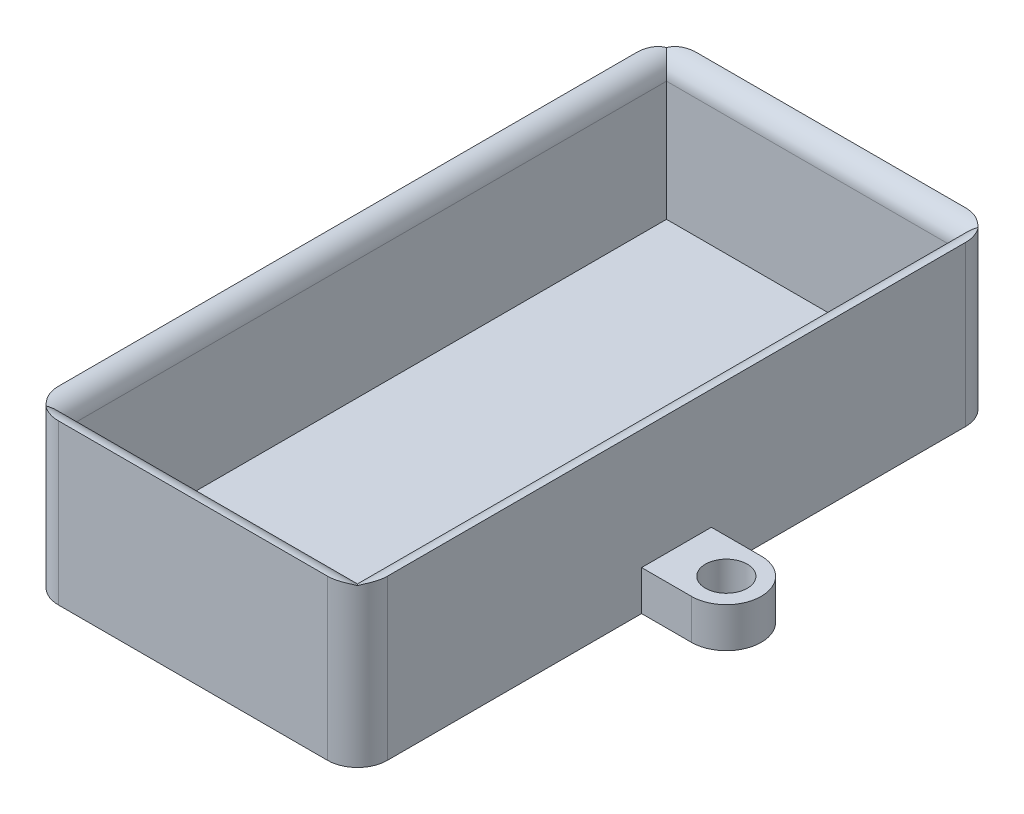
from build123d import *

# Parameters (mm, degrees)
SKETCH2_W           = 33
SKETCH2_H           = 64
SKETCH2_W_2         = 29
SKETCH2_H_2         = 60
BOSS_EXTRUDE1_DEPTH = 14
SKETCH3_W           = 33
SKETCH3_H           = 64
BOSS_EXTRUDE2_DEPTH = 2
SKETCH4_R           = 2.1
BOSS_EXTRUDE3_DEPTH = 4
FILLET1_R           = 3
FILLET2_R           = 2


with BuildPart() as part:
    # Sketch2 → Boss-Extrude1 (new body)
    with BuildSketch(Plane(origin=(0, 0, 0), x_dir=(1, 0, 0), z_dir=(0, 1, 0))):
        Rectangle(SKETCH2_W, SKETCH2_H)
        Rectangle(SKETCH2_W_2, SKETCH2_H_2, mode=Mode.SUBTRACT)
    extrude(amount=BOSS_EXTRUDE1_DEPTH)

    # Sketch3 → Boss-Extrude2 (add)
    with BuildSketch(Plane.XZ):
        Rectangle(SKETCH3_W, SKETCH3_H)
    extrude(amount=BOSS_EXTRUDE2_DEPTH)

    # Sketch4 → Boss-Extrude3 (add)
    # profile 1 of 2: a face of its own
    with BuildSketch(Plane.XZ.offset(2)):
        with BuildLine():
            Line((-21.5, 3.5), (-16.5, 3.5))
            Line((-16.5, 3.5), (-16.5, -3.5))
            Line((-16.5, -3.5), (-21.5, -3.5))
            ThreePointArc((-21.5, -3.5), (-25, 0), (-21.5, 3.5))
        make_face()
        with Locations(Location((-21.5, 0, 0), (0, 0, 270))):
            Circle(SKETCH4_R, mode=Mode.SUBTRACT)
    # profile 2 of 2: a face of its own
    with BuildSketch(Plane.XZ.offset(2)):
        with BuildLine():
            Line((16.5, 3.5), (16.5, -3.5))
            Line((16.5, -3.5), (21.5, -3.5))
            ThreePointArc((21.5, -3.5), (25, 0), (21.5, 3.5))
            Line((21.5, 3.5), (16.5, 3.5))
        make_face()
        with Locations(Location((21.5, 0, 0), (0, 0, 90))):
            Circle(SKETCH4_R, mode=Mode.SUBTRACT)
    extrude(amount=-BOSS_EXTRUDE3_DEPTH)

    # Fillet1
    fillet1_edges = [part.edges().sort_by_distance(p)[0] for p in [
        (16.5, 6, 32),
        (-16.5, 6, 32),
        (-16.5, 6, -32),
        (16.5, 6, -32),
    ]]
    fillet(fillet1_edges, radius=FILLET1_R)

    # Fillet2
    # the kernel refuses this fillet: 2 mm, written as the material it takes off along each edge
    with BuildSketch(Plane(origin=(14.5, 14, -30), x_dir=(1, 0, 0), z_dir=(0, 0, 1)), Plane(origin=(-14.5, 14, 30), x_dir=(-1, 0, 0), z_dir=(0, 0, -1))) as fillet2_piece_1:
        with BuildLine():
            CenterArc((FILLET2_R, -FILLET2_R), FILLET2_R, 90, 90)
            Line((0, -FILLET2_R), (-FILLET2_R * 0.02, -FILLET2_R))
            Line((-FILLET2_R * 0.02, -FILLET2_R), (-FILLET2_R * 0.02, FILLET2_R * 0.02))
            Line((-FILLET2_R * 0.02, FILLET2_R * 0.02), (FILLET2_R, FILLET2_R * 0.02))
            Line((FILLET2_R, FILLET2_R * 0.02), (FILLET2_R, 0))
        make_face()
    extrude(amount=60, mode=Mode.SUBTRACT)
    with BuildSketch(Plane(origin=(-14.5, 14, -30), x_dir=(0, 0, -1), z_dir=(1, 0, 0)), Plane(origin=(14.5, 14, 30), x_dir=(0, 0, 1), z_dir=(-1, 0, 0))) as fillet2_piece_2:
        with BuildLine():
            CenterArc((FILLET2_R, -FILLET2_R), FILLET2_R, 90, 90)
            Line((0, -FILLET2_R), (-FILLET2_R * 0.02, -FILLET2_R))
            Line((-FILLET2_R * 0.02, -FILLET2_R), (-FILLET2_R * 0.02, FILLET2_R * 0.02))
            Line((-FILLET2_R * 0.02, FILLET2_R * 0.02), (FILLET2_R, FILLET2_R * 0.02))
            Line((FILLET2_R, FILLET2_R * 0.02), (FILLET2_R, 0))
        make_face()
    extrude(amount=29, mode=Mode.SUBTRACT)
    with BuildSketch(Plane(origin=(14.5, 14, -35), x_dir=(1, 0, 0), z_dir=(0, 0, 1))) as fillet2_piece_3a_section:
        with BuildLine():
            CenterArc((FILLET2_R, -FILLET2_R), FILLET2_R, 90, 90)
            Line((0, -FILLET2_R), (-FILLET2_R * 0.02, -FILLET2_R))
            Line((-FILLET2_R * 0.02, -FILLET2_R), (-FILLET2_R * 0.02, FILLET2_R * 0.02))
            Line((-FILLET2_R * 0.02, FILLET2_R * 0.02), (FILLET2_R, FILLET2_R * 0.02))
            Line((FILLET2_R, FILLET2_R * 0.02), (FILLET2_R, 0))
        make_face()
    fillet2_piece_3a = extrude(amount=65, mode=Mode.PRIVATE)
    fillet2_piece_3a = split(fillet2_piece_3a, bisect_by=Plane(origin=(14.952790229, 13.547209771, -30), z_dir=(0, 0, -1)), keep=Keep.TOP, mode=Mode.PRIVATE)
    with BuildSketch(Plane(origin=(-14.5, 14, -30), x_dir=(0, 0, -1), z_dir=(1, 0, 0))) as fillet2_piece_3b_section:
        with BuildLine():
            CenterArc((FILLET2_R, -FILLET2_R), FILLET2_R, 90, 90)
            Line((0, -FILLET2_R), (-FILLET2_R * 0.02, -FILLET2_R))
            Line((-FILLET2_R * 0.02, -FILLET2_R), (-FILLET2_R * 0.02, FILLET2_R * 0.02))
            Line((-FILLET2_R * 0.02, FILLET2_R * 0.02), (FILLET2_R, FILLET2_R * 0.02))
            Line((FILLET2_R, FILLET2_R * 0.02), (FILLET2_R, 0))
        make_face()
    fillet2_piece_3b = extrude(amount=34, mode=Mode.PRIVATE)
    fillet2_piece_3b = split(fillet2_piece_3b, bisect_by=Plane(origin=(14.5, 13.547209771, -30.452790229), z_dir=(1, 0, 0)), keep=Keep.TOP, mode=Mode.PRIVATE)
    fillet2_piece_3 = fillet2_piece_3a & fillet2_piece_3b
    add(fillet2_piece_3, mode=Mode.SUBTRACT)
    with BuildSketch(Plane(origin=(19.5, 14, 30), x_dir=(0, 0, 1), z_dir=(-1, 0, 0))) as fillet2_piece_4a_section:
        with BuildLine():
            CenterArc((FILLET2_R, -FILLET2_R), FILLET2_R, 90, 90)
            Line((0, -FILLET2_R), (-FILLET2_R * 0.02, -FILLET2_R))
            Line((-FILLET2_R * 0.02, -FILLET2_R), (-FILLET2_R * 0.02, FILLET2_R * 0.02))
            Line((-FILLET2_R * 0.02, FILLET2_R * 0.02), (FILLET2_R, FILLET2_R * 0.02))
            Line((FILLET2_R, FILLET2_R * 0.02), (FILLET2_R, 0))
        make_face()
    fillet2_piece_4a = extrude(amount=34, mode=Mode.PRIVATE)
    fillet2_piece_4a = split(fillet2_piece_4a, bisect_by=Plane(origin=(14.5, 13.547209771, 30.452790229), z_dir=(1, 0, 0)), keep=Keep.TOP, mode=Mode.PRIVATE)
    with BuildSketch(Plane(origin=(14.5, 14, -30), x_dir=(1, 0, 0), z_dir=(0, 0, 1))) as fillet2_piece_4b_section:
        with BuildLine():
            CenterArc((FILLET2_R, -FILLET2_R), FILLET2_R, 90, 90)
            Line((0, -FILLET2_R), (-FILLET2_R * 0.02, -FILLET2_R))
            Line((-FILLET2_R * 0.02, -FILLET2_R), (-FILLET2_R * 0.02, FILLET2_R * 0.02))
            Line((-FILLET2_R * 0.02, FILLET2_R * 0.02), (FILLET2_R, FILLET2_R * 0.02))
            Line((FILLET2_R, FILLET2_R * 0.02), (FILLET2_R, 0))
        make_face()
    fillet2_piece_4b = extrude(amount=65, mode=Mode.PRIVATE)
    fillet2_piece_4b = split(fillet2_piece_4b, bisect_by=Plane(origin=(14.952790229, 13.547209771, 30), z_dir=(0, 0, 1)), keep=Keep.TOP, mode=Mode.PRIVATE)
    fillet2_piece_4 = fillet2_piece_4a & fillet2_piece_4b
    add(fillet2_piece_4, mode=Mode.SUBTRACT)
    with BuildSketch(Plane(origin=(-14.5, 14, 30), x_dir=(-1, 0, 0), z_dir=(0, 0, -1))) as fillet2_piece_5a_section:
        with BuildLine():
            CenterArc((FILLET2_R, -FILLET2_R), FILLET2_R, 90, 90)
            Line((0, -FILLET2_R), (-FILLET2_R * 0.02, -FILLET2_R))
            Line((-FILLET2_R * 0.02, -FILLET2_R), (-FILLET2_R * 0.02, FILLET2_R * 0.02))
            Line((-FILLET2_R * 0.02, FILLET2_R * 0.02), (FILLET2_R, FILLET2_R * 0.02))
            Line((FILLET2_R, FILLET2_R * 0.02), (FILLET2_R, 0))
        make_face()
    fillet2_piece_5a = extrude(amount=65, mode=Mode.PRIVATE)
    fillet2_piece_5a = split(fillet2_piece_5a, bisect_by=Plane(origin=(-14.952790229, 13.547209771, -30), z_dir=(0, 0, -1)), keep=Keep.TOP, mode=Mode.PRIVATE)
    with BuildSketch(Plane(origin=(-19.5, 14, -30), x_dir=(0, 0, -1), z_dir=(1, 0, 0))) as fillet2_piece_5b_section:
        with BuildLine():
            CenterArc((FILLET2_R, -FILLET2_R), FILLET2_R, 90, 90)
            Line((0, -FILLET2_R), (-FILLET2_R * 0.02, -FILLET2_R))
            Line((-FILLET2_R * 0.02, -FILLET2_R), (-FILLET2_R * 0.02, FILLET2_R * 0.02))
            Line((-FILLET2_R * 0.02, FILLET2_R * 0.02), (FILLET2_R, FILLET2_R * 0.02))
            Line((FILLET2_R, FILLET2_R * 0.02), (FILLET2_R, 0))
        make_face()
    fillet2_piece_5b = extrude(amount=34, mode=Mode.PRIVATE)
    fillet2_piece_5b = split(fillet2_piece_5b, bisect_by=Plane(origin=(-14.5, 13.547209771, -30.452790229), z_dir=(-1, 0, 0)), keep=Keep.TOP, mode=Mode.PRIVATE)
    fillet2_piece_5 = fillet2_piece_5a & fillet2_piece_5b
    add(fillet2_piece_5, mode=Mode.SUBTRACT)
    with BuildSketch(Plane(origin=(-14.5, 14, 35), x_dir=(-1, 0, 0), z_dir=(0, 0, -1))) as fillet2_piece_6a_section:
        with BuildLine():
            CenterArc((FILLET2_R, -FILLET2_R), FILLET2_R, 90, 90)
            Line((0, -FILLET2_R), (-FILLET2_R * 0.02, -FILLET2_R))
            Line((-FILLET2_R * 0.02, -FILLET2_R), (-FILLET2_R * 0.02, FILLET2_R * 0.02))
            Line((-FILLET2_R * 0.02, FILLET2_R * 0.02), (FILLET2_R, FILLET2_R * 0.02))
            Line((FILLET2_R, FILLET2_R * 0.02), (FILLET2_R, 0))
        make_face()
    fillet2_piece_6a = extrude(amount=65, mode=Mode.PRIVATE)
    fillet2_piece_6a = split(fillet2_piece_6a, bisect_by=Plane(origin=(-14.952790229, 13.547209771, 30), z_dir=(0, 0, 1)), keep=Keep.TOP, mode=Mode.PRIVATE)
    with BuildSketch(Plane(origin=(14.5, 14, 30), x_dir=(0, 0, 1), z_dir=(-1, 0, 0))) as fillet2_piece_6b_section:
        with BuildLine():
            CenterArc((FILLET2_R, -FILLET2_R), FILLET2_R, 90, 90)
            Line((0, -FILLET2_R), (-FILLET2_R * 0.02, -FILLET2_R))
            Line((-FILLET2_R * 0.02, -FILLET2_R), (-FILLET2_R * 0.02, FILLET2_R * 0.02))
            Line((-FILLET2_R * 0.02, FILLET2_R * 0.02), (FILLET2_R, FILLET2_R * 0.02))
            Line((FILLET2_R, FILLET2_R * 0.02), (FILLET2_R, 0))
        make_face()
    fillet2_piece_6b = extrude(amount=34, mode=Mode.PRIVATE)
    fillet2_piece_6b = split(fillet2_piece_6b, bisect_by=Plane(origin=(-14.5, 13.547209771, 30.452790229), z_dir=(-1, 0, 0)), keep=Keep.TOP, mode=Mode.PRIVATE)
    fillet2_piece_6 = fillet2_piece_6a & fillet2_piece_6b
    add(fillet2_piece_6, mode=Mode.SUBTRACT)


solid = part.part
